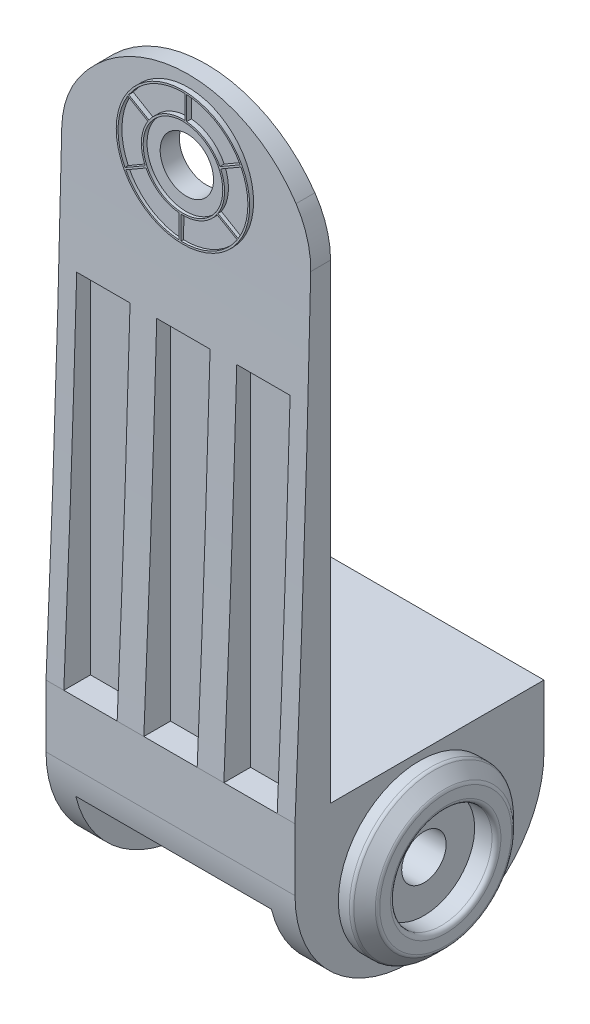
from build123d import *

# Parameters (mm, degrees)
BOSS_EXTRUDE1_DEPTH       = 28
SKETCH2_OUTSIDE_W         = 48.754000000000005
SKETCH2_OUTSIDE_H         = 105.75399999999998
CUT_EXTRUDE1_DEPTH        = 28
CUT_EXTRUDE2_DEPTH        = 28
FILLET1_R                 = 10
FILLET2_R                 = 10
CUT_EXTRUDE3_DEPTH        = 27.000000000000004
CUT_EXTRUDE3_DEPTH_BACK   = 38.00000000000001
SKETCH5_W                 = 6
SKETCH5_H                 = 40
CUT_EXTRUDE4_DEPTH        = 29.00000000000001
SKETCH7_R                 = 3.0000000000000013
CUT_EXTRUDE5_DEPTH        = 29.00000000000001
SKETCH8_R                 = 8.656192168890941
CUT_EXTRUDE6_DEPTH        = 22
SKETCH9_W                 = 1
SKETCH9_H                 = 25.844883421526013
SKETCH9_W_2               = 1.0000000000000018
SKETCH9_W_3               = 1.0000000000000009
CUT_EXTRUDE7_DEPTH        = 17
SKETCH10_R                = 2.500000000000001
CUT_EXTRUDE8_DEPTH        = 36.00000000000001
CUT_EXTRUDE10_DEPTH       = 36.00000000000001
CUT_EXTRUDE10_DEPTH_BACK  = 36.00000000000001
SKETCH15_R                = 2.499999999999999
BOSS_EXTRUDE2_DEPTH       = 0.2
BOSS_EXTRUDE3_START       = -1
BOSS_EXTRUDE3_OUTLINE_R   = 7.502572599
BOSS_EXTRUDE3_OUTLINE_R_2 = 4.475978575
BOSS_EXTRUDE3_DEPTH       = 1.6


with BuildPart() as part:
    # Sketch1 → Boss-Extrude1 (new body)
    with BuildSketch(Plane.XY):
        Polygon((0, 0), (-28, -3.43e-15), (-27.99999999999999, -85), (0, -85), align=None)
    extrude(amount=BOSS_EXTRUDE1_DEPTH)

    # Sketch2 outside → Cut-Extrude1 (cut)
    with BuildSketch(Plane(origin=(0, 0, 0), x_dir=(0, 0, -1), z_dir=(1, 0, 0))):
        with Locations((-14, -42.49999999999999)):
            Rectangle(SKETCH2_OUTSIDE_W, SKETCH2_OUTSIDE_H)
        with BuildLine():
            Line((0, -65), (-24, -65))
            Line((-24, -65), (-24, 0))
            Line((-24, 0), (-26.000000000000004, 0))
            add(Edge.make_bspline(
                [(-26.000000000000004, 0), (-26.53707633645502, -32.51496567844494), (-28, -65)],
                knots=[0, 0, 0, 1, 1, 1], degree=2))
            Line((-28, -65), (-28, -71.99999999999991))
            ThreePointArc((-28, -71.99999999999991), (-24.192388155425125, -81.19238815542512), (-14.99999999999991, -85))
            Line((-14.99999999999991, -85), (-13.00000000000009, -85))
            ThreePointArc((-13.00000000000009, -85), (-3.807611844574879, -81.19238815542512), (0, -71.99999999999991))
            Line((0, -71.99999999999991), (0, -65))
        make_face(mode=Mode.SUBTRACT)
    extrude(amount=-CUT_EXTRUDE1_DEPTH, mode=Mode.SUBTRACT)

    # Sketch3 → Cut-Extrude2 (cut)
    with BuildSketch(Plane.XY):
        with BuildLine():
            Line((-27.999999999999996, -9.883057591347281), (-40.027748888686126, -8.853102522661063))
            Line((-40.027748888686126, -8.853102522661063), (-40.027748888686126, 1.5971756728532023))
            Line((-40.027748888686126, 1.5971756728532023), (-25.704290662666573, 6.274223256859585))
            Line((-25.704290662666573, 6.274223256859585), (3.3810990003731165, 5.835750045858987))
            Line((3.3810990003731165, 5.835750045858987), (10.3966703763827, -7.829998363659662))
            Line((10.3966703763827, -7.829998363659662), (0, -9.883057591347285))
            ThreePointArc((0, -9.883057591347285), (-13.999999999999998, 0), (-27.999999999999996, -9.883057591347281))
        make_face()
    extrude(amount=CUT_EXTRUDE2_DEPTH, mode=Mode.SUBTRACT)

    # Fillet1
    fillet1_edges = [part.edges().sort_by_distance(p)[0] for p in [
        (0, -9.883057591347285, 25.09232264739429),
    ]]
    fillet(fillet1_edges, radius=FILLET1_R)

    # Fillet2
    fillet2_edges = [part.edges().sort_by_distance(p)[0] for p in [
        (-27.999999999999993, -9.883057591347281, 25.09232264739429),
    ]]
    fillet(fillet2_edges, radius=FILLET2_R)

    # Sketch4 → Cut-Extrude3 (cut, two sides: drawn at the far end of the back side and taken through both)
    with BuildSketch(Plane.XY.offset(25).offset(-CUT_EXTRUDE3_DEPTH_BACK)):
        Polygon((-25, -75.00000000000001), (-3, -75.00000000000001), (-2.999999999999999, -85), (-4.844937199797929, -87.22450892200496), (-25, -85), align=None)
    extrude(amount=CUT_EXTRUDE3_DEPTH + CUT_EXTRUDE3_DEPTH_BACK, mode=Mode.SUBTRACT)

    # Sketch5 → Cut-Extrude4 (cut)
    with BuildSketch(Plane.XY.offset(25)):
        with Locations((-23.000000000000004, -45)):
            Rectangle(SKETCH5_W, SKETCH5_H)
        with Locations((-14, -45)):
            Rectangle(SKETCH5_W, SKETCH5_H)
        with Locations((-5, -45)):
            Rectangle(SKETCH5_W, SKETCH5_H)
    extrude(amount=CUT_EXTRUDE4_DEPTH, mode=Mode.SUBTRACT)

    # Sketch7 → Cut-Extrude5 (cut)
    with BuildSketch(Plane.XY):
        with Locations(Location((-14, -8.76223441087419, 0), (0, 0, 180))):
            Circle(SKETCH7_R)
    extrude(amount=CUT_EXTRUDE5_DEPTH, mode=Mode.SUBTRACT)

    # Sketch8 → Cut-Extrude6 (cut)
    with BuildSketch(Plane(origin=(-3, 0, 0), x_dir=(0, 0, -1), z_dir=(1, 0, 0))):
        with Locations((-14.000000000000012, -74.66029837215065)):
            Circle(SKETCH8_R)
    extrude(amount=-CUT_EXTRUDE6_DEPTH, mode=Mode.SUBTRACT)

    # Sketch9 → Cut-Extrude7 (cut)
    with BuildSketch(Plane(origin=(0, -83, 0), x_dir=(1, 0, 0), z_dir=(0, 1, 0))):
        with Locations((-24.00069476346859, -14.154991804626984)):
            Rectangle(SKETCH9_W, SKETCH9_H)
        with Locations((-22.000694763468587, -14.154991804626984)):
            Rectangle(SKETCH9_W, SKETCH9_H)
        with Locations((-20.00069476346859, -14.154991804626984)):
            Rectangle(SKETCH9_W, SKETCH9_H)
        with Locations((-18.00069476346859, -14.154991804626984)):
            Rectangle(SKETCH9_W, SKETCH9_H)
        with Locations((-16.00069476346859, -14.154991804626984)):
            Rectangle(SKETCH9_W_2, SKETCH9_H)
        with Locations((-14.00069476346859, -14.154991804626984)):
            Rectangle(SKETCH9_W_2, SKETCH9_H)
        with Locations((-12.00069476346859, -14.154991804626984)):
            Rectangle(SKETCH9_W_2, SKETCH9_H)
        with Locations((-10.00069476346859, -14.154991804626984)):
            Rectangle(SKETCH9_W_2, SKETCH9_H)
        with Locations((-8.00069476346859, -14.154991804626984)):
            Rectangle(SKETCH9_W_2, SKETCH9_H)
        with Locations((-6.000694763468587, -14.154991804626984)):
            Rectangle(SKETCH9_W_3, SKETCH9_H)
        with Locations((-4.000694763468589, -14.154991804626984)):
            Rectangle(SKETCH9_W_3, SKETCH9_H)
    extrude(amount=CUT_EXTRUDE7_DEPTH, mode=Mode.SUBTRACT)

    # Sketch10 → Cut-Extrude8 (cut)
    with BuildSketch(Plane(origin=(0, 0, 0), x_dir=(0, 0, -1), z_dir=(1, 0, 0))):
        with Locations((-14.000000000000002, -75.00000000000001)):
            Circle(SKETCH10_R)
    extrude(amount=-CUT_EXTRUDE8_DEPTH, mode=Mode.SUBTRACT)

    # Sketch12 → Revolve2 (revolve)
    with BuildSketch(Plane.XY.offset(14), mode=Mode.PRIVATE) as revolve2_sk:
        with BuildLine():
            Line((0, -72.50000000000001), (-1.1e-16, -65.86514035253262))
            Line((-1.1e-16, -65.86514035253262), (1.2369800753128706, -65.86514035253262))
            ThreePointArc((1.2369800753128706, -65.86514035253262), (1.428321791495415, -65.90320058627698), (1.5905334659061443, -66.01158696193934))
            Line((1.5905334659061443, -66.01158696193934), (2.802604792378018, -67.22365828841119))
            ThreePointArc((2.802604792378018, -67.22365828841119), (2.910991168040393, -67.38586996282193), (2.94905140178475, -67.57721167900448))
            Line((2.94905140178475, -67.57721167900448), (2.94905140178475, -68.78703733780054))
            ThreePointArc((2.94905140178475, -68.78703733780054), (2.8026047923780224, -69.14059072839382), (2.4490514017847462, -69.28703733780054))
            Line((2.4490514017847462, -69.28703733780054), (0.5, -69.28703733780054))
            Line((0.5, -69.28703733780054), (0.5, -72.50000000000001))
            Line((0.5, -72.50000000000001), (0.5, -74.99291973056286))
            Line((0.5, -74.99291973056286), (0, -74.99291973056286))
            Line((0, -74.99291973056286), (0, -72.50000000000001))
        make_face()
    revolve(revolve2_sk.sketch.rotate(Axis((0, -74.99291973056286, 14), (1, 0, 0)), 90), axis=Axis((0, -74.99291973056286, 14), (1, 0, 0)))

    # Mirror2: part across plane


with BuildPart() as part_1:
    add(part.part)
    add(part.part.mirror(Plane(origin=(-14, 0, 0), x_dir=(0, 0, 1), z_dir=(1, 0, 0))))

    # Sketch15 → Cut-Extrude10 (cut, two sides: drawn at the far end of the back side and taken through both)
    with BuildSketch(Plane(origin=(-14, 0, 0), x_dir=(0, 0, -1), z_dir=(1, 0, 0)).offset(-CUT_EXTRUDE10_DEPTH_BACK)):
        with Locations((-14.000000000000002, -75.00000000000001)):
            Circle(SKETCH15_R)
    extrude(amount=CUT_EXTRUDE10_DEPTH + CUT_EXTRUDE10_DEPTH_BACK, mode=Mode.SUBTRACT)

    # Sketch17 → Boss-Extrude2 (add)
    with BuildSketch(Plane(origin=(0, 0, 24), x_dir=(-1, 0, 0), z_dir=(0, 0, -1))):
        Polygon((14, -1.2622344108741899), (14.199999999999935, -3.2622344108746253), (14.800000000000027, -3.26223441087463), (15, -1.2622344108741899), align=None)
        Polygon((15.509738900664951, -1.4157598514804808), (16.48926884191744, -1.6170583715691398), (15.890765813489566, -3.535858550056834), (15.303047848737977, -3.4150794380036156), align=None)
        Polygon((16.95766891334989, -1.8700508237224598), (17.87662672497012, -2.2644066788357757), (16.904123452419284, -4.02345113105399), (16.352748765447068, -3.7868376179859586), align=None)
        Polygon((18.284511613210945, -2.606508601819617), (19.105275054418215, -3.177776816914408), (17.79858593598695, -4.705050056310379), (17.30612787126251, -4.362289127253449), align=None)
        Polygon((19.4359459042184, -3.5949825178065407), (20.12491282329409, -4.31977530503566), (18.53753386502041, -5.552750585741533), (18.124153713574938, -5.11787491340399), align=None)
        Polygon((20.364831931210635, -4.7950043334219705), (20.893795941537594, -5.64364859091672), (19.09071462448234, -6.531847760071952), (18.77333621828612, -6.022661205575021), align=None)
        Polygon((21.033140991103103, -6.1574450145380375), (21.380446243947922, -7.095197146685115), (19.435480929084395, -7.602257225945522), (19.227097777377473, -7.039605946657185), align=None)
        Polygon((21.413512432460838, -7.626526079589865), (21.56494020996541, -8.614994403917972), (19.557718005807843, -8.720156294061598), (19.466861339305087, -8.127075299464641), align=None)
        Polygon((21.490373803782898, -9.142103177164536), (21.439724634944184, -10.140819684335586), (19.45242145436938, -9.839778045223957), (19.48281095567262, -9.240548140921234), align=None)
        Polygon((21.260578391496534, -10.642128402814594), (21.009925859237814, -11.610205521680793), (19.12390212795672, -10.915285033390031), (19.274293647311975, -10.33443876207022), align=None)
        Polygon((20.73353404678056, -12.065190547556446), (20.293139895222925, -12.962995087127185), (18.585609646392562, -11.902645876097603), (18.849846137327187, -11.363963152355076), align=None)
        Polygon((19.930818027032736, -13.35302927998166), (19.31871204448508, -14.143805016919357), (17.859581767118847, -12.761437904436246), (18.2268453566475, -12.286972462273559), align=None)
        Polygon((18.885293620416668, -14.452920331070121), (18.12653549772388, -15.104292813792341), (16.97554215681768, -13.456502071862001), (17.43079703043343, -13.06567858222861), align=None)
        Polygon((17.639764718983113, -15.319834031958555), (16.765418102838535, -15.805135994489634), (15.969683501005045, -13.959382369693884), (16.494291470691877, -13.668201192175193), align=None)
        Polygon((16.245223422300185, -15.918278833874554), (15.29108416590014, -16.21764195684791), (14.883185771233272, -14.249490819452731), (15.45566932507339, -14.069872945668694), align=None)
        Polygon((14.758762414905743, -16.223754336313405), (13.763893091513852, -16.324922658300835), (13.760530312217291, -14.314950347119126), (14.357451906252521, -14.254249353926662), align=None)
        Polygon((13.241237585094261, -16.2237543363134), (12.246368261702365, -16.12258601432597), (12.647678770355627, -14.153081031939225), (13.244600364390854, -14.2137820251317), align=None)
        Polygon((11.754776577699815, -15.918278833874554), (10.800637321299767, -15.618915710901199), (11.590191418526604, -13.770509822695347), (12.162674972366714, -13.95012769647939), align=None)
        Polygon((10.360235281016893, -15.319834031958557), (9.485888664872311, -14.834532069427475), (10.631361913163598, -13.182899229644141), (11.155969882850403, -13.474080407162827), align=None)
        Polygon((9.114706379583335, -14.452920331070123), (8.355948256890546, -13.801547848347907), (9.810444846873908, -12.414306099506513), (10.265699720489554, -12.805129589139812), align=None)
        Polygon((8.069181972967261, -13.35302927998166), (7.457075990419598, -12.562253543043965), (9.161048660804896, -11.496196725335947), (9.528312250333508, -11.970662167498578), align=None)
        Polygon((7.266465953219435, -12.065190547556444), (6.826071801661802, -11.167386007985707), (8.70975971111519, -10.46615861278437), (8.973996202049813, -11.004841336526894), align=None)
        Polygon((6.739421608503471, -10.642128402814594), (6.4887690762447505, -9.674051283948394), (8.47505382042934, -9.366361643204156), (8.625445339784573, -9.947207914523865), align=None)
        Polygon((6.509626196217105, -9.142103177164536), (6.458977027378391, -8.143386669993488), (8.466539875488671, -8.241831633750353), (8.496929376791906, -8.841061538052942), align=None)
        Polygon((6.586487567539164, -7.6265260795898655), (6.73791534504374, -6.638057755261755), (8.684566438199482, -7.138606975136588), (8.593709771696721, -7.731687969733529), align=None)
        Polygon((6.9668590088969, -6.157445014538038), (7.314164261741716, -5.219692882390959), (9.120207475467337, -6.101853814510144), (8.91182432376041, -6.664505093798475), align=None)
        Polygon((7.635168068789368, -4.7950043334219705), (8.164132079116328, -3.9463600759272204), (9.755627792040826, -5.174016948080303), (9.438249385844596, -5.683203502577231), align=None)
        Polygon((8.5640540957816, -3.5949825178065407), (9.253021014857286, -2.87018973057742), (10.564813205500727, -4.3930821261749), (10.15143305405525, -4.827957798512437), align=None)
        Polygon((9.715488386789058, -2.606508601819617), (10.536251827996331, -2.0352403867248245), (11.514635569944737, -3.791020912158682), (11.022177505220293, -4.133781841215607), align=None)
        Polygon((11.04233108665011, -1.8700508237224598), (11.96128889827034, -1.4756949686091414), (12.56620904617313, -3.3924817628726602), (12.014834359200908, -3.629095275940683), align=None)
        Polygon((12.490261099335049, -1.4157598514804812), (13.469791040587541, -1.214461331391821), (13.676482092514478, -3.213780917914959), (13.088764127762914, -3.3345600299681704), align=None)
    extrude(amount=BOSS_EXTRUDE2_DEPTH)

    # Boss-Extrude3: read off the stored shape, not the designer's step
    # Boss-Extrude3 outline → Boss-Extrude3 (add)
    with BuildSketch(Plane.XY.offset(26).offset(BOSS_EXTRUDE3_START)):
        with Locations((-14, -8.762234411)):
            Circle(BOSS_EXTRUDE3_OUTLINE_R)
        with BuildLine():
            ThreePointArc((-14.419545186, -16.052745258), (-17.92454856, -14.920601497), (-20.431127263, -12.221738523))
            Line((-20.431127263, -12.221738523), (-18.15482286, -10.907513563))
            ThreePointArc((-18.15482286, -10.907513563), (-16.609318996, -12.642470231), (-14.419545186, -13.419353421))
            Line((-14.419545186, -13.419353421), (-14.419545186, -16.052745258))
        make_face(mode=Mode.SUBTRACT)
        with BuildLine():
            ThreePointArc((-7.896004993, -12.770826623), (-10.628971937, -15.240176705), (-14.219545186, -16.061506051))
            Line((-14.219545186, -16.061506051), (-14.219545186, -13.433056132))
            ThreePointArc((-14.219545186, -13.433056132), (-11.944276705, -12.962088858), (-10.176589222, -11.454130705))
            Line((-10.176589222, -11.454130705), (-7.896004993, -12.770826623))
        make_face(mode=Mode.SUBTRACT)
        with BuildLine():
            ThreePointArc((-7.476459807, -5.480315776), (-6.704423378, -9.081809619), (-7.788417923, -12.602001939))
            Line((-7.788417923, -12.602001939), (-10.064722326, -11.287776979))
            ThreePointArc((-10.064722326, -11.287776979), (-9.33495771, -9.081853038), (-9.757044036, -6.797011695))
            Line((-9.757044036, -6.797011695), (-7.476459807, -5.480315776))
        make_face(mode=Mode.SUBTRACT)
        with BuildLine():
            ThreePointArc((-20.523540193, -12.044153045), (-21.295576622, -8.442659203), (-20.211582077, -4.922466883))
            Line((-20.211582077, -4.922466883), (-17.935277674, -6.236691842))
            ThreePointArc((-17.935277674, -6.236691842), (-18.66504229, -8.442615784), (-18.242955964, -10.727457127))
            Line((-18.242955964, -10.727457127), (-20.523540193, -12.044153045))
        make_face(mode=Mode.SUBTRACT)
        with BuildLine():
            ThreePointArc((-13.780454814, -4.09141269), (-16.055723295, -4.562379964), (-17.823410778, -6.070338117))
            Line((-17.823410778, -6.070338117), (-20.103995007, -4.753642199))
            ThreePointArc((-20.103995007, -4.753642199), (-17.371028063, -2.284292117), (-13.780454814, -1.462962771))
            Line((-13.780454814, -1.462962771), (-13.780454814, -4.09141269))
        make_face(mode=Mode.SUBTRACT)
        with Locations((-14, -8.762234411)):
            Circle(BOSS_EXTRUDE3_OUTLINE_R_2, mode=Mode.SUBTRACT)
        with BuildLine():
            ThreePointArc((-9.84517714, -6.616955258), (-11.390681004, -4.881998591), (-13.580454814, -4.105115401))
            Line((-13.580454814, -4.105115401), (-13.580454814, -1.471723564))
            ThreePointArc((-13.580454814, -1.471723564), (-10.07545144, -2.603867325), (-7.568872737, -5.302730299))
            Line((-7.568872737, -5.302730299), (-9.84517714, -6.616955258))
        make_face(mode=Mode.SUBTRACT)
    extrude(amount=BOSS_EXTRUDE3_DEPTH)


solid = part_1.part
